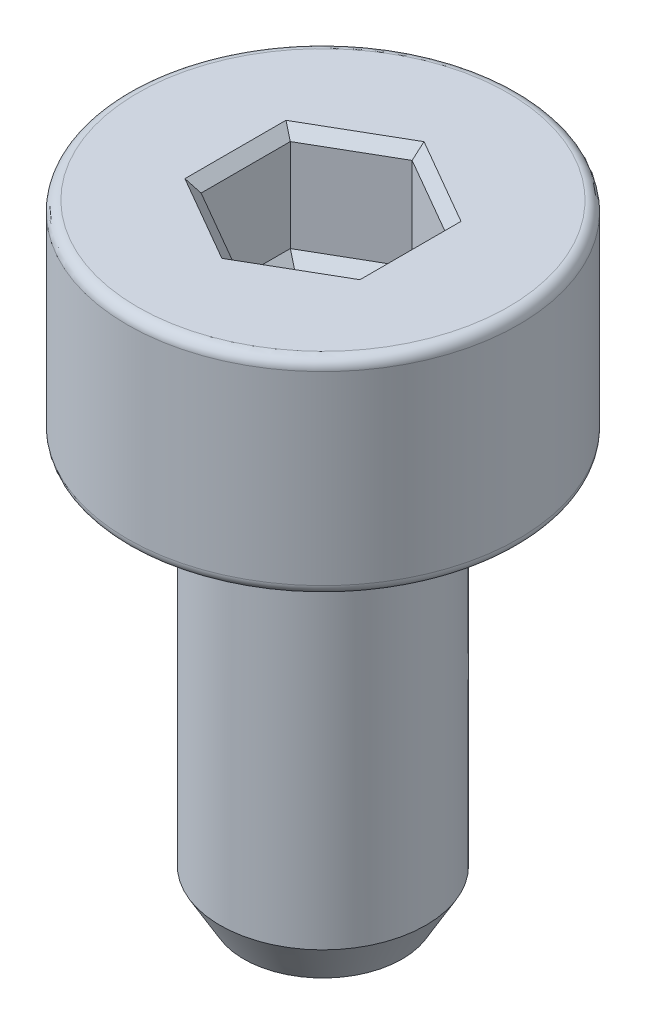
from build123d import *

# Parameters (mm, degrees)
SKETCH1_R           = 1
BOSS_EXTRUDE1_DEPTH = 4
SKETCH2_R           = 1.9
BOSS_EXTRUDE2_DEPTH = 2
CUT_EXTRUDE1_DEPTH  = 1
FILLET1_R           = 0.1
CHAMFER1_SIZE       = 0.1
CHAMFER2_SIZE       = 0.1
CUT_EXTRUDE2_DEPTH  = 0.1
CUT_EXTRUDE2_DRAFT  = -45


with BuildPart() as part:
    # Sketch1 → Boss-Extrude1 (new body)
    with BuildSketch(Plane(origin=(0, 0, 0), x_dir=(1, 0, 0), z_dir=(0, 1, 0))):
        Circle(SKETCH1_R)
    extrude(amount=BOSS_EXTRUDE1_DEPTH)

    # Sketch2 → Boss-Extrude2 (add)
    with BuildSketch(Plane(origin=(0, 4, 0), x_dir=(1, 0, 0), z_dir=(0, 1, 0))):
        Circle(SKETCH2_R)
    extrude(amount=BOSS_EXTRUDE2_DEPTH)

    # Sketch3 → Cut-Extrude1 (cut)
    with BuildSketch(Plane(origin=(0, 6, 0), x_dir=(1, 0, 0), z_dir=(0, 1, 0))):
        Polygon((0, 0.866025404), (-0.75, 0.433012702), (-0.75, -0.433012702), (0, -0.866025404), (0.75, -0.433012702), (0.75, 0.433012702), align=None)
    extrude(amount=-CUT_EXTRUDE1_DEPTH, mode=Mode.SUBTRACT)

    # Fillet1
    fillet1_edges = [part.edges().sort_by_distance(p)[0] for p in [
        (-1.9, 4, 0),
        (-1.9, 6, 0),
    ]]
    fillet(fillet1_edges, radius=FILLET1_R)

    # Chamfer1
    chamfer1_edges = [part.edges().sort_by_distance(p)[0] for p in [
        (-1, 0, 0),
    ]]
    chamfer(chamfer1_edges, length=CHAMFER1_SIZE)

    # Sketch4 → Cut-Revolve1 (revolve, cut)
    with BuildSketch(Plane.XY):
        Polygon((1, 0), (1, 0.4), (0.769059892, 0), align=None)
    revolve(axis=Axis((0, 0, 0), (0, 1, 0)), mode=Mode.SUBTRACT)

    # Chamfer2
    chamfer2_edges = [part.edges().sort_by_distance(p)[0] for p in [
        (-0.75, 6, 0),
        (-0.375, 6, 0.649519053),
        (0.375, 6, 0.649519053),
        (0.75, 6, 0),
        (0.375, 6, -0.649519053),
        (-0.375, 6, -0.649519053),
    ]]
    chamfer(chamfer2_edges, length=CHAMFER2_SIZE)


with BuildPart() as cut_extrude2_tool:
    # Sketch6 → Cut-Extrude2 (with draft: the straight prism first)
    with BuildSketch(Plane(origin=(0, 5, 0), x_dir=(1, 0, 0), z_dir=(0, 1, 0))):
        Polygon((0, 0.866025404), (-0.75, 0.433012702), (-0.75, -0.433012702), (0, -0.866025404), (0.75, -0.433012702), (0.75, 0.433012702), align=None)
    extrude(amount=-CUT_EXTRUDE2_DEPTH)
    # Cut-Extrude2: the draft: its side faces are tilted about the plane it starts from
    cut_extrude2_sides = [cut_extrude2_tool.faces().sort_by_distance(p)[0] for p in [
        (-0.375, 4.95, -0.649519053),
        (-0.75, 4.95, 0),
        (-0.375, 4.95, 0.649519053),
        (0.375, 4.95, 0.649519053),
        (0.75, 4.95, 0),
        (0.375, 4.95, -0.649519053),
    ]]
    draft(cut_extrude2_sides, Plane(origin=(0, 5, 0), x_dir=(1, 0, 0), z_dir=(0, 1, 0)), CUT_EXTRUDE2_DRAFT)


with BuildPart() as part_1:
    add(part.part)

    # Cut-Extrude2: cut by cut_extrude2_tool
    add(cut_extrude2_tool.part, mode=Mode.SUBTRACT)


solid = part_1.part
